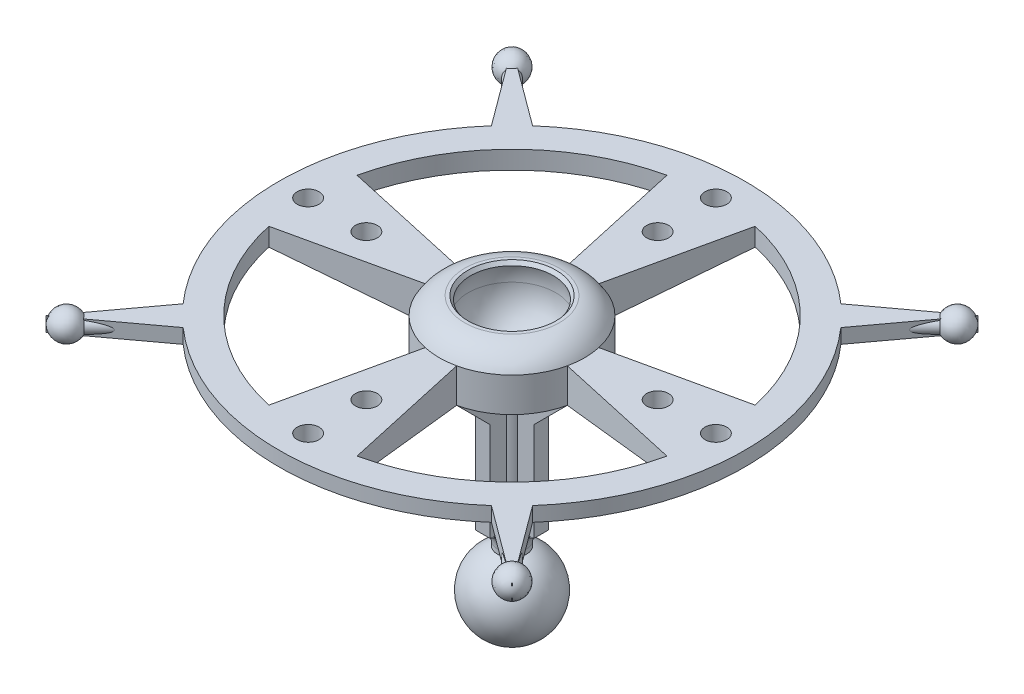
from build123d import *

# Parameters (mm, degrees)
SKETCH4_R                            = 0.75
CUT_EXTRUDE2_DEPTH                   = 4
SKETCH3_W                            = 1
SKETCH3_H                            = 4
SKETCH3_W_2                          = 4
SKETCH3_H_2                          = 1
BOSS_EXTRUDE1_DEPTH                  = 8
BOSS_EXTRUDE1_DIRECTION_2_REACH      = 29.203
BOSS_EXTRUDE1_DIRECTION_2_END_RADIUS = 4
BOSS_EXTRUDE3_DEPTH                  = 0.5
BOSS_EXTRUDE2_DEPTH                  = 1
CIRPATTERN1_COUNT                    = 2
CIRPATTERN1_ANGLE                    = 90
CHAMFER1_SIZE                        = 0.269138326
CHAMFER2_SIZE                        = 0.190346895


with BuildPart() as part:
    # Sketch1 → Revolve1 (revolve)
    with BuildSketch(Plane(origin=(0, 0, 0), x_dir=(0, 0, -1), z_dir=(1, 0, 0))):
        with BuildLine():
            ThreePointArc((-3, 4), (-2.121320344, 1.878679656), (0, 1))
            Line((0, 1), (0, 0))
            Line((0, 0), (0, -9.5))
            Line((0, -9.5), (0, -15.1))
            ThreePointArc((0, -15.1), (-2.753447859, -12.808453427), (-1, -9.684660634))
            Line((-1, -9.684660634), (-1, 0.127016654))
            ThreePointArc((-1, 0.127016654), (-2.123180734, 0.609999474), (-3.048002331, 1.409694653))
            Line((-3.048002331, 1.409694653), (-16, 3))
            Line((-16, 3), (-16, 4))
            Line((-16, 4), (-4, 4))
            Line((-4, 4), (-3, 4))
        make_face()
    revolve(axis=Axis((0, 10.634252877, 0), (0, 1, 0)))

    # Sketch4 → Cut-Extrude2 (cut)
    with BuildSketch(Plane(origin=(0, 4, 0), x_dir=(1, 0, 0), z_dir=(0, 1, 0))):
        with BuildLine():
            Line((-1.08219807, 4.881480036), (-3.030154595, 13.6681441))
            ThreePointArc((-3.030154595, 13.6681441), (-9.899494937, 9.899494937), (-13.6681441, 3.030154595))
            Line((-13.6681441, 3.030154595), (-4.881480036, 1.08219807))
            ThreePointArc((-4.881480036, 1.08219807), (-3.535533906, 3.535533906), (-1.08219807, 4.881480036))
        make_face()
        with BuildLine():
            Line((-4.881480036, -1.08219807), (-13.6681441, -3.030154595))
            ThreePointArc((-13.6681441, -3.030154595), (-9.899494937, -9.899494937), (-3.030154595, -13.6681441))
            Line((-3.030154595, -13.6681441), (-1.08219807, -4.881480036))
            ThreePointArc((-1.08219807, -4.881480036), (-3.535533906, -3.535533906), (-4.881480036, -1.08219807))
        make_face()
        with BuildLine():
            ThreePointArc((3.030154595, -13.6681441), (9.899494937, -9.899494937), (13.6681441, -3.030154595))
            Line((13.6681441, -3.030154595), (4.881480036, -1.08219807))
            ThreePointArc((4.881480036, -1.08219807), (3.535533906, -3.535533906), (1.08219807, -4.881480036))
            Line((1.08219807, -4.881480036), (3.030154595, -13.6681441))
        make_face()
        with BuildLine():
            ThreePointArc((13.6681441, 3.030154595), (9.899494937, 9.899494937), (3.030154595, 13.6681441))
            Line((3.030154595, 13.6681441), (1.08219807, 4.881480036))
            ThreePointArc((1.08219807, 4.881480036), (3.535533906, 3.535533906), (4.881480036, 1.08219807))
            Line((4.881480036, 1.08219807), (13.6681441, 3.030154595))
        make_face()
        with Locations(Location((-14, 0, 0), (0, 0, 134.876670286))):
            Circle(SKETCH4_R)
        with Locations(Location((-10, 0, 0), (0, 0, 43.63623207))):
            Circle(SKETCH4_R)
        with Locations(Location((0, 10, 0), (0, 0, 270))):
            Circle(SKETCH4_R)
        with Locations(Location((0, 14, 0), (0, 0, 270))):
            Circle(SKETCH4_R)
        with Locations(Location((0, -10, 0), (0, 0, 90))):
            Circle(SKETCH4_R)
        with Locations(Location((0, -14, 0), (0, 0, 270.000000015))):
            Circle(SKETCH4_R)
        with Locations(Location((10, 0, 0), (0, 0, 270))):
            Circle(SKETCH4_R)
        with Locations(Location((14, 0, 0), (0, 0, 270))):
            Circle(SKETCH4_R)
    extrude(amount=-CUT_EXTRUDE2_DEPTH, mode=Mode.SUBTRACT)

    # Sketch3 → Boss-Extrude1 (add)
    with BuildSketch(Plane(origin=(0, 0, 0), x_dir=(1, 0, 0), z_dir=(0, 1, 0))):
        Rectangle(SKETCH3_W, SKETCH3_H)
        Rectangle(SKETCH3_W_2, SKETCH3_H_2)
    extrude(amount=-BOSS_EXTRUDE1_DEPTH)

    # Boss-Extrude1 direction 2: up to this sphere (the profile starts outside it)
    boss_extrude1_direction_2_end = Location((0, 4, 0)) * Sphere(BOSS_EXTRUDE1_DIRECTION_2_END_RADIUS, mode=Mode.PRIVATE)
    # Sketch3 → Boss-Extrude1 direction 2 (add, up to the surface)
    with BuildSketch(Plane(origin=(0, 0, 0), x_dir=(1, 0, 0), z_dir=(0, 1, 0)), mode=Mode.PRIVATE) as boss_extrude1_direction_2_sk1:
        Rectangle(SKETCH3_W, SKETCH3_H)
    boss_extrude1_direction_2_tool1 = extrude(boss_extrude1_direction_2_sk1.sketch, amount=BOSS_EXTRUDE1_DIRECTION_2_REACH, mode=Mode.PRIVATE) - boss_extrude1_direction_2_end
    add(boss_extrude1_direction_2_tool1.solids().sort_by_distance((0, 0, 0))[0])
    # Sketch3 → Boss-Extrude1 direction 2 (add, up to the surface)
    with BuildSketch(Plane(origin=(0, 0, 0), x_dir=(1, 0, 0), z_dir=(0, 1, 0)), mode=Mode.PRIVATE) as boss_extrude1_direction_2_sk2:
        Rectangle(SKETCH3_W_2, SKETCH3_H_2)
    boss_extrude1_direction_2_tool2 = extrude(boss_extrude1_direction_2_sk2.sketch, amount=BOSS_EXTRUDE1_DIRECTION_2_REACH, mode=Mode.PRIVATE) - boss_extrude1_direction_2_end
    add(boss_extrude1_direction_2_tool2.solids().sort_by_distance((0, 0, 0))[0])

    # Sketch6 → Boss-Extrude3 (add, symmetric)
    with BuildSketch(Plane.XY):
        Polygon((-4.881480036, 1.64936983), (-2, -1.232110206), (2, -1.232110206), (4.881480036, 1.64936983), align=None)
    boss_extrude3 = extrude(amount=BOSS_EXTRUDE3_DEPTH, both=True)

    # Sketch5 → Boss-Extrude2 (add)
    with BuildSketch(Plane(origin=(0, 4, 0), x_dir=(1, 0, 0), z_dir=(0, 1, 0))):
        with BuildLine():
            ThreePointArc((-11.998696572, 10.584483009), (-11.313708499, 11.313708499), (-10.584483009, 11.998696572))
            Line((-10.584483009, 11.998696572), (-16, 16))
            Line((-16, 16), (-11.998696572, 10.584483009))
        make_face()
        with BuildLine():
            Line((16, 16), (10.584483009, 11.998696572))
            ThreePointArc((10.584483009, 11.998696572), (11.313708499, 11.313708499), (11.998696572, 10.584483009))
            Line((11.998696572, 10.584483009), (16, 16))
        make_face()
        with BuildLine():
            ThreePointArc((11.998696572, -10.584483009), (11.313708499, -11.313708499), (10.584483009, -11.998696572))
            Line((10.584483009, -11.998696572), (16, -16))
            Line((16, -16), (11.998696572, -10.584483009))
        make_face()
        with BuildLine():
            ThreePointArc((-10.584483009, -11.998696572), (-11.313708499, -11.313708499), (-11.998696572, -10.584483009))
            Line((-11.998696572, -10.584483009), (-16, -16))
            Line((-16, -16), (-10.584483009, -11.998696572))
        make_face()
    extrude(amount=-BOSS_EXTRUDE2_DEPTH)

    # CirPattern1: Boss-Extrude3 ×2 about axis
    cirpattern1_axis = Axis((0, 0, 0), (0, -1, 0))
    for i in range(1, CIRPATTERN1_COUNT):
        add(boss_extrude3.rotate(cirpattern1_axis, i * CIRPATTERN1_ANGLE / (CIRPATTERN1_COUNT - 1)))

    # Sketch7 → Cut-Revolve2 (revolve, cut)
    with BuildSketch(Plane(origin=(0, 0, 0), x_dir=(0, 0, -1), z_dir=(1, 0, 0)), mode=Mode.PRIVATE) as cut_revolve2_sk:
        with BuildLine():
            Line((-3, 3.872983346), (0, 3.872983346))
            Line((0, 3.872983346), (0, 0.872983346))
            ThreePointArc((0, 0.872983346), (-2.121320344, 1.751663003), (-3, 3.872983346))
        make_face()
    revolve(cut_revolve2_sk.sketch.rotate(Axis((0, 10.026262899, 0), (0, 1, 0)), 5.863807408), axis=Axis((0, 10.026262899, 0), (0, 1, 0)), mode=Mode.SUBTRACT)

    # Sketch11 → Revolve6 (revolve)
    with BuildSketch(Plane(origin=(0, 0, 0), x_dir=(0, 0, -1), z_dir=(1, 0, 0)), mode=Mode.PRIVATE) as revolve6_sk:
        with BuildLine():
            ThreePointArc((-3, 4), (-2.936835031, 4.612372436), (-2.75, 5.198957881))
            Line((-2.75, 5.198957881), (-3.25, 5.198957881))
            ThreePointArc((-3.25, 5.198957881), (-4.264416921, 4.802972003), (-5, 4))
            Line((-5, 4), (-3, 4))
        make_face()
    revolve(revolve6_sk.sketch.rotate(Axis((0, 3.68034089, 0), (0, 1, 0)), 5.863807408), axis=Axis((0, 3.68034089, 0), (0, 1, 0)))

    # Chamfer1
    # the kernel refuses this chamfer: 0.269138326, 0.25 mm, written as the material it takes off along each edge
    with BuildSketch(Plane(origin=(0, 5.198957881, 0), x_dir=(0.10216418254961841, 0, 0.9947675506388255), z_dir=(-0.9947675506388255, 0, 0.10216418254961841))) as chamfer1_piece_1:
        with BuildLine():
            Line((2.842387665, -0.239357774), (2.75 + CHAMFER1_SIZE, 0))
            Line((2.75 + CHAMFER1_SIZE, 0), (2.75, 0))
            ThreePointArc((2.75, 0), (2.799795086, -0.121392348), (2.842387665, -0.239357774))
        make_face()
    revolve(axis=Axis((0, 5.198957881, 0), (0, 1, 0)), mode=Mode.SUBTRACT)

    # Revolve7: read off the stored shape, not the designer's step
    # Revolve7 outline → Revolve7 (revolve)
    with BuildSketch(Plane.XY):
        with BuildLine():
            Line((2, -8), (1, -8))
            Line((1, -8), (1, -9.37271642))
            ThreePointArc((1, -9.37271642), (1.311634774, -8.549137424), (2, -8))
        make_face()
    revolve(axis=Axis((0, 0, 0), (0, 1, 0)))

    # Chamfer2
    # the kernel refuses this chamfer: 0.25, 0.190346895 mm, written as the material it takes off along each edge
    with BuildSketch(Plane(origin=(0, -8, 0), x_dir=(-0.09858739785447071, 0, 0.9951283962304986), z_dir=(-0.9951283962304986, 0, -0.09858739785447071))) as chamfer2_piece_1_section:
        with BuildLine():
            Line((2 - CHAMFER2_SIZE * 1.00000000146, 0), (1.758495163, -0.128126454))
            ThreePointArc((1.758495163, -0.128126454), (1.873225944, -0.060894867), (2, 0))
            Line((2, 0), (2 - CHAMFER2_SIZE * 1.00000000146, 0))
        make_face()
    chamfer2_piece_1 = revolve(axis=Axis((0, -8, 0), (0, 1, 0)), revolution_arc=101.31566474, mode=Mode.PRIVATE)
    chamfer2_piece_1 = split(chamfer2_piece_1, bisect_by=Plane(origin=(0, -8, 0.5), z_dir=(0, 0, 1)), keep=Keep.TOP, mode=Mode.PRIVATE)
    chamfer2_piece_1 = split(chamfer2_piece_1, bisect_by=Plane(origin=(0.5, -8, 0), z_dir=(1, 0, 0)), keep=Keep.TOP, mode=Mode.PRIVATE)
    add(chamfer2_piece_1, mode=Mode.SUBTRACT)
    with BuildSketch(Plane(origin=(0, -8, 0), x_dir=(-0.9951283962305012, 0, -0.09858739785444545), z_dir=(0.09858739785444545, 0, -0.9951283962305012))) as chamfer2_piece_2_section:
        with BuildLine():
            Line((2 - CHAMFER2_SIZE * 1.00000000146, 0), (1.758495163, -0.128126454))
            ThreePointArc((1.758495163, -0.128126454), (1.873225944, -0.060894867), (2, 0))
            Line((2, 0), (2 - CHAMFER2_SIZE * 1.00000000146, 0))
        make_face()
    chamfer2_piece_2 = revolve(axis=Axis((0, -8, 0), (0, 1, 0)), revolution_arc=101.31566474, mode=Mode.PRIVATE)
    chamfer2_piece_2 = split(chamfer2_piece_2, bisect_by=Plane(origin=(0, -8, 0.5), z_dir=(0, 0, 1)), keep=Keep.TOP, mode=Mode.PRIVATE)
    chamfer2_piece_2 = split(chamfer2_piece_2, bisect_by=Plane(origin=(-0.5, -8, 0), z_dir=(-1, 0, 0)), keep=Keep.TOP, mode=Mode.PRIVATE)
    add(chamfer2_piece_2, mode=Mode.SUBTRACT)
    with BuildSketch(Plane(origin=(0, -8, 0), x_dir=(0.09858739785448163, 0, -0.9951283962304975), z_dir=(0.9951283962304975, 0, 0.09858739785448163))) as chamfer2_piece_3_section:
        with BuildLine():
            Line((2 - CHAMFER2_SIZE * 1.00000000146, 0), (1.758495163, -0.128126454))
            ThreePointArc((1.758495163, -0.128126454), (1.873225944, -0.060894867), (2, 0))
            Line((2, 0), (2 - CHAMFER2_SIZE * 1.00000000146, 0))
        make_face()
    chamfer2_piece_3 = revolve(axis=Axis((0, -8, 0), (0, 1, 0)), revolution_arc=101.31566474, mode=Mode.PRIVATE)
    chamfer2_piece_3 = split(chamfer2_piece_3, bisect_by=Plane(origin=(0, -8, -0.5), z_dir=(0, 0, -1)), keep=Keep.TOP, mode=Mode.PRIVATE)
    chamfer2_piece_3 = split(chamfer2_piece_3, bisect_by=Plane(origin=(-0.5, -8, 0), z_dir=(-1, 0, 0)), keep=Keep.TOP, mode=Mode.PRIVATE)
    add(chamfer2_piece_3, mode=Mode.SUBTRACT)
    with BuildSketch(Plane(origin=(0, -8, 0), x_dir=(0.9951283962305019, 0, 0.09858739785443787), z_dir=(-0.09858739785443787, 0, 0.9951283962305019))) as chamfer2_piece_4_section:
        with BuildLine():
            Line((2 - CHAMFER2_SIZE * 1.00000000146, 0), (1.758495163, -0.128126454))
            ThreePointArc((1.758495163, -0.128126454), (1.873225944, -0.060894867), (2, 0))
            Line((2, 0), (2 - CHAMFER2_SIZE * 1.00000000146, 0))
        make_face()
    chamfer2_piece_4 = revolve(axis=Axis((0, -8, 0), (0, 1, 0)), revolution_arc=101.31566474, mode=Mode.PRIVATE)
    chamfer2_piece_4 = split(chamfer2_piece_4, bisect_by=Plane(origin=(0.5, -8, 0), z_dir=(1, 0, 0)), keep=Keep.TOP, mode=Mode.PRIVATE)
    chamfer2_piece_4 = split(chamfer2_piece_4, bisect_by=Plane(origin=(0, -8, -0.5), z_dir=(0, 0, -1)), keep=Keep.TOP, mode=Mode.PRIVATE)
    add(chamfer2_piece_4, mode=Mode.SUBTRACT)


with BuildPart() as body_2:
    # Sketch9 → Revolve2 (revolve)
    with BuildSketch(Plane(origin=(0, 3.5, 0), x_dir=(1, 0, 0), z_dir=(0, 1, 0))):
        with BuildLine():
            Line((11.291589791, 11.291589791), (16, 16))
            ThreePointArc((16, 16), (16.145093814, 14.809363246), (15.043036986, 14.335930205))
            Line((15.043036986, 14.335930205), (11.645143181, 10.9380364))
            Line((11.645143181, 10.9380364), (11.291589791, 11.291589791))
        make_face()
    revolve(axis=Axis((16.91636103, 3.5, -16.91636103), (0.7071067811865444, 0, -0.7071067811865507)))


with BuildPart() as body_3:
    # Sketch9<6> → Revolve3 (revolve)
    with BuildSketch(Plane(origin=(0, 3.5, 0), x_dir=(1, 0, 0), z_dir=(0, 1, 0)), mode=Mode.PRIVATE) as revolve3_sk:
        with BuildLine():
            Line((-11.291589791, 11.291589791), (-11.645143181, 10.9380364))
            Line((-11.645143181, 10.9380364), (-15.043036986, 14.335930205))
            ThreePointArc((-15.043036986, 14.335930205), (-16.145093814, 14.809363246), (-16, 16))
            Line((-16, 16), (-11.291589791, 11.291589791))
        make_face()
    revolve(revolve3_sk.sketch.rotate(Axis((-16.91636103, 3.5, -16.91636103), (-0.7071067811865444, 0, -0.7071067811865507)), 180), axis=Axis((-16.91636103, 3.5, -16.91636103), (-0.7071067811865444, 0, -0.7071067811865507)))


with BuildPart() as body_4:
    # Sketch9<8> → Revolve4 (revolve)
    with BuildSketch(Plane(origin=(0, 3.5, 0), x_dir=(1, 0, 0), z_dir=(0, 1, 0))):
        with BuildLine():
            Line((-11.291589791, -11.291589791), (-16, -16))
            ThreePointArc((-16, -16), (-16.145093814, -14.809363246), (-15.043036986, -14.335930205))
            Line((-15.043036986, -14.335930205), (-11.645143181, -10.9380364))
            Line((-11.645143181, -10.9380364), (-11.291589791, -11.291589791))
        make_face()
    revolve(axis=Axis((-16.91636103, 3.5, 16.91636103), (-0.7071067811865444, 0, 0.7071067811865507)))


with BuildPart() as body_5:
    # Sketch9<9> → Revolve5 (revolve)
    with BuildSketch(Plane(origin=(0, 3.5, 0), x_dir=(1, 0, 0), z_dir=(0, 1, 0)), mode=Mode.PRIVATE) as revolve5_sk:
        with BuildLine():
            Line((11.291589791, -11.291589791), (11.645143181, -10.9380364))
            Line((11.645143181, -10.9380364), (15.043036986, -14.335930205))
            ThreePointArc((15.043036986, -14.335930205), (16.145093814, -14.809363246), (16, -16))
            Line((16, -16), (11.291589791, -11.291589791))
        make_face()
    revolve(revolve5_sk.sketch.rotate(Axis((16.91636103, 3.5, 16.91636103), (0.7071067811865444, 0, 0.7071067811865507)), 180), axis=Axis((16.91636103, 3.5, 16.91636103), (0.7071067811865444, 0, 0.7071067811865507)))


solid = Compound([part.part, body_2.part, body_3.part, body_4.part, body_5.part])
